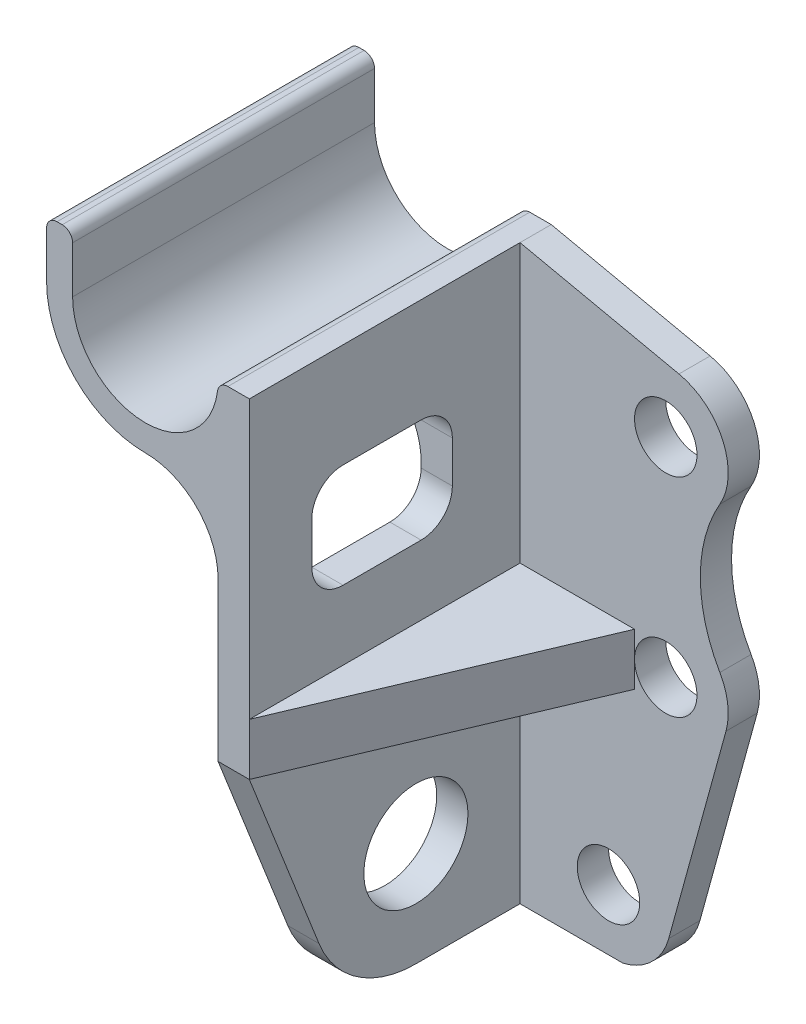
from build123d import *
from OCP.BRepAlgoAPI import BRepAlgoAPI_Cut
from OCP.TopTools import TopTools_ListOfShape

# Parameters (mm, degrees)
BOSS_EXTRUDE1_DEPTH = 58
SKETCH1_4_R         = 6
BOSS_EXTRUDE3_DEPTH = 6
CUT_EXTRUDE8_DEPTH  = 26
RIB14_REACH         = 110.472
SKETCH8_WALL_W      = 275.405915094
SKETCH8_WALL_H      = 10
SKETCH10_R          = 10
CUT_EXTRUDE10_DEPTH = 21


with BuildPart() as part:
    # Sketch1 → Boss-Extrude1 (new body)
    with BuildSketch(Plane.XY):
        with BuildLine():
            Line((-18.973896199, 9), (-18.973896199, 0))
            ThreePointArc((-18.973896199, 0), (-13.421880234, -13.411258999), (-0.015020694, -18.973890253))
            ThreePointArc((-0.015020694, -18.973890253), (9.87730883, -23.078310175), (13.973896199, -32.973885866))
            Line((13.973896199, -32.973885866), (13.973896199, -108))
            ThreePointArc((13.973896199, -108), (14.559682636, -109.414213562), (15.973896199, -110))
            Line((15.973896199, -110), (19.973896199, -110))
            Line((19.973896199, -110), (19.973896199, 0))
            Line((19.973896199, 0), (15.848197366, 0))
            ThreePointArc((15.848197366, 0), (14.525476133, -0.499863827), (13.863935397, -1.749591462))
            ThreePointArc((13.863935397, -1.749591462), (-0.876521771, -13.946378905), (-13.973896199, 0))
            Line((-13.973896199, 0), (-13.973896199, 9))
            ThreePointArc((-13.973896199, 9), (-14.559682636, 10.414213562), (-15.973896199, 11))
            Line((-15.973896199, 11), (-16.973896199, 11))
            ThreePointArc((-16.973896199, 11), (-18.388109761, 10.414213562), (-18.973896199, 9))
        make_face()
    extrude(amount=BOSS_EXTRUDE1_DEPTH)

    # Sketch1<4> → Boss-Extrude3 (add)
    with BuildSketch(Plane.XY):
        with BuildLine():
            Line((19.973896199, 0), (19.973896199, -110))
            Line((19.973896199, -110), (39.726458462, -110))
            ThreePointArc((39.726458462, -110), (45.301079262, -106.960444534), (48.544360912, -101.501834946))
            Line((48.544360912, -101.501834946), (59.544360912, -61.501834946))
            ThreePointArc((59.544360912, -61.501834946), (59.876313249, -56.792715074), (58.366201044, -52.31995715))
            ThreePointArc((58.366201044, -52.31995715), (54.61491235, -38.31995715), (58.366201044, -24.31995715))
            ThreePointArc((58.366201044, -24.31995715), (58.944097052, -13.456348075), (50.505709466, -6.590084108))
            Line((50.505709466, -6.590084108), (19.973896199, 0))
        make_face()
        with Locations((36.973896199, -98.31995715)):
            Circle(SKETCH1_4_R, mode=Mode.SUBTRACT)
        with Locations((47.973896199, -58.31995715)):
            Circle(SKETCH1_4_R, mode=Mode.SUBTRACT)
        with Locations((47.973896199, -18.31995715)):
            Circle(SKETCH1_4_R, mode=Mode.SUBTRACT)
    extrude(amount=BOSS_EXTRUDE3_DEPTH)

    # Sketch6 → Cut-Extrude8 (cut)
    with BuildSketch(Plane(origin=(19.973896199, 0, 0), x_dir=(0, 0, -1), z_dir=(1, 0, 0))):
        with BuildLine():
            Line((-40, -40), (-25, -40))
            ThreePointArc((-25, -40), (-20.757359313, -38.242640687), (-19, -34))
            Line((-19, -34), (-19, -26))
            ThreePointArc((-19, -26), (-20.757359313, -21.757359313), (-25, -20))
            Line((-25, -20), (-40, -20))
            ThreePointArc((-40, -20), (-44.242640687, -21.757359313), (-46, -26))
            Line((-46, -26), (-46, -34))
            ThreePointArc((-46, -34), (-44.242640687, -38.242640687), (-40, -40))
        make_face()
    extrude(amount=-CUT_EXTRUDE8_DEPTH, mode=Mode.SUBTRACT)

    # Sketch8 wall → Rib14 (add, up to next)
    with BuildSketch(Plane(origin=(30.973896199, -58.31995715, 32), x_dir=(0.389639990837, 0, -0.920967251069), z_dir=(-0.920967251069, 0, -0.389639990837)), mode=Mode.PRIVATE) as rib14_sk1:
        Rectangle(SKETCH8_WALL_W, SKETCH8_WALL_H)
    rib14_tool1 = extrude(rib14_sk1.sketch, amount=RIB14_REACH, mode=Mode.PRIVATE) - part.part
    add(rib14_tool1.solids().sort_by_distance((30.973896199, -58.31995715, 32))[0])


with BuildPart() as cut_extrude10_tool:
    # Sketch10 → Cut-Extrude10 (new body)
    with BuildSketch(Plane(origin=(19.973896199, 0, 0), x_dir=(0, 0, -1), z_dir=(1, 0, 0))):
        with BuildLine():
            ThreePointArc((-26.000000311, -110), (-37.257208214, -106.531039387), (-44.609335124, -97.327526611))
            Line((-44.609335124, -97.327526611), (-58, -63.31995715))
            Line((-58, -63.31995715), (-58, -110))
            Line((-58, -110), (-26.000000311, -110))
        make_face()
        with Locations((-26, -90)):
            Circle(SKETCH10_R)
    extrude(amount=-CUT_EXTRUDE10_DEPTH)


with BuildPart() as part_1:
    add(part.part)

    # Cut-Extrude10: cut by cut_extrude10_tool, with a tolerance
    cut_extrude10_stock = TopTools_ListOfShape()
    cut_extrude10_stock.Append(part_1.part.wrapped)
    cut_extrude10_tools = TopTools_ListOfShape()
    cut_extrude10_tools.Append(cut_extrude10_tool.part.wrapped)
    cut_extrude10_cut = BRepAlgoAPI_Cut()
    cut_extrude10_cut.SetArguments(cut_extrude10_stock)
    cut_extrude10_cut.SetTools(cut_extrude10_tools)
    cut_extrude10_cut.SetFuzzyValue(0.00001)
    cut_extrude10_cut.Build()
    add(Compound.cast(cut_extrude10_cut.Shape()).solids(), mode=Mode.REPLACE)


solid = part_1.part
